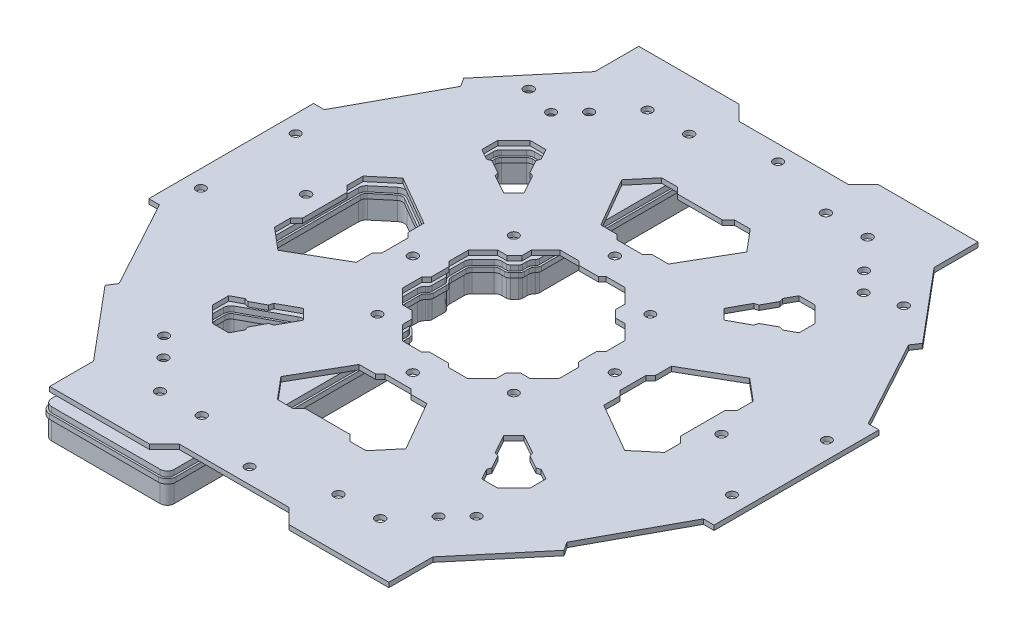
from build123d import *

# Parameters (mm, degrees)
BOSS_EXTRUDE1_DEPTH     = 1.6
CUT_EXTRUDE2_DEPTH      = 325.215508964
CUT_EXTRUDE2_DEPTH_BACK = 325.215508964
SKETCH3_R               = 1.55
SKETCH3_R_2             = 1.59
CUT_EXTRUDE3_DEPTH      = 325.215508964
CUT_EXTRUDE4_DEPTH      = 325.215508964
CUT_EXTRUDE5_DEPTH      = 325.215508964
CUT_EXTRUDE5_DEPTH_BACK = 325.215508964
SKETCH11_R              = 1.5
SKETCH11_R_2            = 1.03775
SKETCH11_R_3            = 1.25
SKETCH11_R_4            = 1.59
SKETCH11_R_5            = 3.75
SKETCH11_R_6            = 1.22275
BOSS_EXTRUDE3_DEPTH     = 1.6
FILLET1_R               = 3
CUT_EXTRUDE6_DEPTH      = 327.551906235
CUT_EXTRUDE7_DEPTH      = 327.551906235
FILLET2_R               = 2
FILLET3_R               = 2
MOVE_FACE1_BY           = 0.5
MOVE_FACE1_2_BY         = 0.5
MOVE_FACE1_3_BY         = 0.5
MOVE_FACE1_4_BY         = 0.5
MOVE_FACE1_5_BY         = 0.5
MOVE_FACE1_6_BY         = 0.5
CUT_EXTRUDE8_DEPTH      = 327.563665257
CUT_EXTRUDE8_DEPTH_BACK = 327.563665257
SKETCH16_R              = 1.25
SKETCH16_R_2            = 1.375
SKETCH15_R              = 4.385
BOSS_EXTRUDE4_DEPTH     = 10


with BuildPart() as part:
    # Sketch2 → Boss-Extrude1 (new body)
    with BuildSketch(Plane(origin=(0, 0, 0), x_dir=(1, 0, 0), z_dir=(0, 1, 0))):
        Polygon((52.096119502, -237.160208319), (52.096119502, -251.908535498), (85.721119502, -251.908535498), (90.721119502, -246.908535498), (127.471119502, -246.908535498), (132.471119502, -251.908535498), (166.096119502, -251.908535498), (166.096119502, -237.160208319), (186.224888619, -213.171675409), (184.368153405, -210.312553906), (200.496119502, -180.608535498), (204.096119502, -180.608535498), (204.096119502, -125.208535498), (200.496119502, -125.208535498), (184.368153405, -95.50451709), (186.224888619, -92.645395588), (166.096119502, -68.656862678), (166.096119502, -53.908535498), (132.471119502, -53.908535498), (127.471119502, -58.908535498), (90.721119502, -58.908535498), (85.721119502, -53.908535498), (52.096119502, -53.908535498), (52.096119502, -68.656862678), (31.967350385, -92.645395588), (33.824085599, -95.50451709), (17.696119502, -125.208535498), (14.096119502, -125.208535498), (14.096119502, -180.608535498), (17.696119502, -180.608535498), (33.824085599, -210.312553906), (31.967350385, -213.171675409), align=None)
    extrude(amount=BOSS_EXTRUDE1_DEPTH)

    # Sketch3 → Cut-Extrude2 (cut, two sides: drawn at the far end of the back side and taken through both)
    with BuildSketch(Plane(origin=(0, 0, 0), x_dir=(1, 0, 0), z_dir=(0, 1, 0)).offset(-CUT_EXTRUDE2_DEPTH_BACK)):
        with Locations((155.314639835, -81.386832051)):
            Circle(SKETCH3_R)
        with Locations((62.877599169, -81.386832051)):
            Circle(SKETCH3_R)
        with Locations((62.877599169, -224.430238946)):
            Circle(SKETCH3_R)
        with Locations((155.314639835, -224.430238946)):
            Circle(SKETCH3_R)
        with Locations((56.588874452, -87.871468679)):
            Circle(SKETCH3_R)
        with Locations((56.588874452, -217.945602318)):
            Circle(SKETCH3_R)
        with Locations((161.603364552, -87.871468679)):
            Circle(SKETCH3_R)
        with Locations((161.603364552, -217.945602318)):
            Circle(SKETCH3_R)
        with Locations((132.024071785, -175.836487781)):
            Circle(SKETCH3_R)
        with Locations((86.16816722, -175.836487781)):
            Circle(SKETCH3_R)
        with Locations((86.16816722, -129.980583216)):
            Circle(SKETCH3_R)
        with Locations((132.024071785, -129.980583216)):
            Circle(SKETCH3_R)
        with Locations((19.843114754, -136.971507714)):
            Circle(SKETCH3_R)
        with Locations((19.843114754, -168.845563283)):
            Circle(SKETCH3_R)
        with Locations((198.349124251, -136.971507714)):
            Circle(SKETCH3_R)
        with Locations((198.349124251, -168.845563283)):
            Circle(SKETCH3_R)
        with Locations((178.900678494, -152.908535498)):
            Circle(SKETCH3_R_2)
        with Locations((39.29156051, -152.908535498)):
            Circle(SKETCH3_R_2)
        with Locations((75.142742617, -152.908535498)):
            Circle(SKETCH3_R_2)
        with Locations((143.049496387, -152.908535498)):
            Circle(SKETCH3_R_2)
        with Locations((109.096119502, -118.955158614)):
            Circle(SKETCH3_R_2)
        with Locations((109.096119502, -186.861912383)):
            Circle(SKETCH3_R_2)
        with Locations((72.103705793, -71.004269418)):
            Circle(SKETCH3_R_2)
        with Locations((86.127086468, -71.004269418)):
            Circle(SKETCH3_R_2)
        with Locations((132.065152536, -71.004269418)):
            Circle(SKETCH3_R_2)
        with Locations((146.088533212, -71.004269418)):
            Circle(SKETCH3_R_2)
        with Locations((72.103705793, -234.812801579)):
            Circle(SKETCH3_R_2)
        with Locations((86.127086468, -234.812801579)):
            Circle(SKETCH3_R_2)
        with Locations((132.065152536, -234.812801579)):
            Circle(SKETCH3_R_2)
        with Locations((146.088533212, -234.812801579)):
            Circle(SKETCH3_R_2)
        with Locations((109.096119502, -64.102955151)):
            Circle(SKETCH3_R)
        with Locations((109.096119502, -241.714115846)):
            Circle(SKETCH3_R)
        with Locations((46.068110388, -84.875039907)):
            Circle(SKETCH3_R_2)
        with Locations((172.124128616, -84.875039907)):
            Circle(SKETCH3_R_2)
    extrude(amount=CUT_EXTRUDE2_DEPTH + CUT_EXTRUDE2_DEPTH_BACK, mode=Mode.SUBTRACT)

    # Sketch5 → Cut-Extrude3 (cut, through all)
    with BuildSketch(Plane(origin=(0, 0, 0), x_dir=(1, 0, 0), z_dir=(0, 1, 0))):
        Polygon((104.733231944, -113.906337065), (113.459007061, -113.906337065), (115.059007061, -112.306337065), (120.47821146, -112.306337065), (130.10321146, -95.635348043), (123.996729168, -88.357925833), (118.646729168, -88.357925833), (116.596119502, -90.408535498), (101.596119502, -90.408535498), (99.545509837, -88.357925833), (94.195509837, -88.357925833), (88.089027545, -95.635348043), (97.714027545, -112.306337065), (103.133231944, -112.306337065), align=None)
        Polygon((115.059007061, -193.510733931), (113.459007061, -191.910733931), (104.733231944, -191.910733931), (103.133231944, -193.510733931), (97.714027545, -193.510733931), (88.089027545, -210.181722954), (94.195509837, -217.459145164), (99.545509837, -217.459145164), (101.596119502, -215.408535498), (116.596119502, -215.408535498), (118.646729168, -217.459145164), (123.996729168, -217.459145164), (130.10321146, -210.181722954), (120.47821146, -193.510733931), align=None)
        Polygon((150.696119502, -158.871423057), (150.696119502, -164.290627456), (167.367108525, -173.915627456), (174.644530735, -167.809145164), (174.644530735, -162.459145164), (172.593921069, -160.408535498), (172.593921069, -145.408535498), (174.644530735, -143.357925833), (174.644530735, -138.007925833), (167.367108525, -131.901443541), (150.696119502, -141.526443541), (150.696119502, -146.94564794), (149.096119502, -148.54564794), (149.096119502, -157.271423057), align=None)
        Polygon((67.496119502, -141.526443541), (50.825130479, -131.901443541), (43.54770827, -138.007925833), (43.54770827, -143.357925833), (45.598317935, -145.408535498), (45.598317935, -160.408535498), (43.54770827, -162.459145164), (43.54770827, -167.809145164), (50.825130479, -173.915627456), (67.496119502, -164.290627456), (67.496119502, -158.871423057), (69.096119502, -157.271423057), (69.096119502, -148.54564794), (67.496119502, -146.94564794), align=None)
    extrude(amount=CUT_EXTRUDE3_DEPTH, mode=Mode.SUBTRACT)

    # Sketch9 → Cut-Extrude4 (cut, through all)
    with BuildSketch(Plane(origin=(0, 0, 0), x_dir=(1, 0, 0), z_dir=(0, 1, 0))):
        Polygon((84.346119502, -155.908535498), (84.346119502, -149.908535498), (82.766119502, -148.328535498), (82.766119502, -141.828535498), (87.666119502, -136.928535498), (90.866119502, -136.928535498), (93.366119502, -134.428535498), (93.366119502, -131.228535498), (98.166119502, -126.428535498), (104.586119502, -126.428535498), (105.886119502, -127.728535498), (112.306119502, -127.728535498), (113.606119502, -126.428535498), (120.026119502, -126.428535498), (124.826119502, -131.228535498), (124.826119502, -134.428535498), (127.326119502, -136.928535498), (130.526119502, -136.928535498), (135.426119502, -141.828535498), (135.426119502, -148.328535498), (133.846119502, -149.908535498), (133.846119502, -155.908535498), (135.426119502, -157.488535498), (135.426119502, -163.988535498), (130.526119502, -168.888535498), (127.326119502, -168.888535498), (124.826119502, -171.388535498), (124.826119502, -174.588535498), (120.026119502, -179.388535498), (113.606119502, -179.388535498), (112.306119502, -178.088535498), (105.886119502, -178.088535498), (104.586119502, -179.388535498), (98.166119502, -179.388535498), (93.366119502, -174.588535498), (93.366119502, -171.388535498), (90.866119502, -168.888535498), (87.666119502, -168.888535498), (82.766119502, -163.988535498), (82.766119502, -157.488535498), align=None)
    extrude(amount=CUT_EXTRUDE4_DEPTH, mode=Mode.SUBTRACT)

    # Sketch10 → Cut-Extrude5 (cut, two sides: drawn at the far end of the back side and taken through both)
    with BuildSketch(Plane(origin=(0, 0, 0), x_dir=(1, 0, 0), z_dir=(0, 1, 0)).offset(-CUT_EXTRUDE5_DEPTH_BACK)):
        Polygon((55.765156438, -104.981807497), (61.169391501, -99.577572434), (66.568586991, -99.594120554), (68.513414537, -103.150933011), (68.115766366, -104.508090309), (70.586272925, -109.026294774), (71.943430223, -109.423942945), (75.452480676, -115.841496206), (72.02908021, -119.264896672), (65.611526949, -115.755846219), (65.213878778, -114.398688921), (60.695674313, -111.928182362), (59.338517015, -112.325830534), (55.781704558, -110.381002987), align=None)
        Polygon((72.02908021, -186.552174325), (65.611526949, -190.061224778), (65.213878778, -191.418382076), (60.695674313, -193.888888634), (59.338517015, -193.491240463), (55.781704558, -195.436068009), (55.765156438, -200.8352635), (61.169391501, -206.239498563), (66.568586991, -206.222950443), (68.513414537, -202.666137986), (68.115766366, -201.308980688), (70.586272925, -196.790776223), (71.943430223, -196.393128052), (75.452480676, -189.975574791), align=None)
        Polygon((162.427082567, -200.8352635), (157.022847504, -206.239498563), (151.623652013, -206.222950443), (149.678824467, -202.666137986), (150.076472638, -201.308980688), (147.60596608, -196.790776223), (146.248808781, -196.393128052), (142.739758329, -189.975574791), (146.163158795, -186.552174325), (152.580712056, -190.061224778), (152.978360227, -191.418382076), (157.496564692, -193.888888634), (158.85372199, -193.491240463), (162.410534446, -195.436068009), align=None)
        Polygon((146.163158795, -119.264896672), (152.580712056, -115.755846219), (152.978360227, -114.398688921), (157.496564692, -111.928182362), (158.85372199, -112.325830534), (162.410534446, -110.381002987), (162.427082567, -104.981807497), (157.022847504, -99.577572434), (151.623652013, -99.594120554), (149.678824467, -103.150933011), (150.076472638, -104.508090309), (147.60596608, -109.026294774), (146.248808781, -109.423942945), (142.739758329, -115.841496206), align=None)
    extrude(amount=CUT_EXTRUDE5_DEPTH + CUT_EXTRUDE5_DEPTH_BACK, mode=Mode.SUBTRACT)


with BuildPart() as body_2:
    # Sketch11 → Boss-Extrude3 (new body)
    with BuildSketch(Plane(origin=(0, 0, 0), x_dir=(1, 0, 0), z_dir=(0, 1, 0))):
        Polygon((94.596119502, -175.818535498), (93.366119502, -174.588535498), (93.366119502, -171.388535498), (90.866119502, -168.888535498), (87.666119502, -168.888535498), (82.766119502, -163.988535498), (82.766119502, -157.488535498), (84.346119502, -155.908535498), (84.346119502, -149.908535498), (82.766119502, -148.328535498), (82.766119502, -141.828535498), (87.666119502, -136.928535498), (90.866119502, -136.928535498), (93.366119502, -134.428535498), (93.366119502, -131.228535498), (94.596119502, -129.998535498), (94.596119502, -53.908535498), (52.096119502, -53.908535498), (52.096119502, -68.656862678), (31.967350385, -92.645395588), (33.824085599, -95.50451709), (24.096119502, -113.421201828), (24.096119502, -192.395869169), (33.824085599, -210.312553906), (32.152138529, -213.391897343), (52.096119502, -237.160208319), (52.096119502, -254.908535498), (94.596119502, -254.908535498), align=None)
        with BuildLine():
            ThreePointArc((36.045744784, -192.908535498), (37.395744784, -191.558535498), (38.745744784, -192.908535498))
            ThreePointArc((38.745744784, -192.908535498), (37.395744784, -194.258535498), (36.045744784, -192.908535498))
        make_face(mode=Mode.SUBTRACT)
        with Locations((41.901157442, -175.408535498)):
            Circle(SKETCH11_R, mode=Mode.SUBTRACT)
        with Locations((72.103705793, -234.812801579)):
            Circle(SKETCH11_R_2, mode=Mode.SUBTRACT)
        with BuildLine():
            ThreePointArc((53.896870849, -220.556275909), (53.978200861, -215.253598715), (59.280878055, -215.334928726))
            Line((59.280878055, -215.334928726), (65.569602772, -221.819565354))
            ThreePointArc((65.569602772, -221.819565354), (65.488272761, -227.122242548), (60.185595566, -227.040912537))
            Line((60.185595566, -227.040912537), (53.896870849, -220.556275909))
        make_face(mode=Mode.SUBTRACT)
        with BuildLine():
            ThreePointArc((85.045744784, -250.908535498), (86.395744784, -249.558535498), (87.745744784, -250.908535498))
            ThreePointArc((87.745744784, -250.908535498), (86.395744784, -252.258535498), (85.045744784, -250.908535498))
        make_face(mode=Mode.SUBTRACT)
        with Locations((86.103705793, -234.812801579)):
            Circle(SKETCH11_R_2, mode=Mode.SUBTRACT)
        with Locations((92.206195383, -220.408566663)):
            Circle(SKETCH11_R_3, mode=Mode.SUBTRACT)
        with Locations((92.206195383, -210.408535498)):
            Circle(SKETCH11_R_3, mode=Mode.SUBTRACT)
        Polygon((55.765156438, -200.8352635), (55.781704558, -195.436068009), (59.338517015, -193.491240463), (60.695674313, -193.888888634), (65.213878778, -191.418382076), (65.611526949, -190.061224778), (72.02908021, -186.552174325), (75.452480676, -189.975574791), (71.943430223, -196.393128052), (70.586272925, -196.790776223), (68.115766366, -201.308980688), (68.513414537, -202.666137986), (66.568586991, -206.222950443), (61.169391501, -206.239498563), align=None, mode=Mode.SUBTRACT)
        with BuildLine():
            ThreePointArc((85.045744784, -192.908535498), (86.395744784, -191.558535498), (87.745744784, -192.908535498))
            ThreePointArc((87.745744784, -192.908535498), (86.395744784, -194.258535498), (85.045744784, -192.908535498))
        make_face(mode=Mode.SUBTRACT)
        with Locations((86.901157442, -175.408535498)):
            Circle(SKETCH11_R, mode=Mode.SUBTRACT)
        with Locations((39.29156051, -152.908535498)):
            Circle(SKETCH11_R_4, mode=Mode.SUBTRACT)
        with Locations((41.901157442, -130.408535498)):
            Circle(SKETCH11_R, mode=Mode.SUBTRACT)
        Polygon((50.825130479, -173.915627456), (43.54770827, -167.809145164), (43.54770827, -162.459145164), (45.598317935, -160.408535498), (45.598317935, -145.408535498), (43.54770827, -143.357925833), (43.54770827, -138.007925833), (50.825130479, -131.901443541), (67.496119502, -141.526443541), (67.496119502, -146.94564794), (69.096119502, -148.54564794), (69.096119502, -157.271423057), (67.496119502, -158.871423057), (67.496119502, -164.290627456), align=None, mode=Mode.SUBTRACT)
        with Locations((46.068110388, -84.875039907)):
            Circle(SKETCH11_R_5, mode=Mode.SUBTRACT)
        with Locations((75.142742617, -152.908535498)):
            Circle(SKETCH11_R_4, mode=Mode.SUBTRACT)
        Polygon((65.611526949, -115.755846219), (65.213878778, -114.398688921), (60.695674313, -111.928182362), (59.338517015, -112.325830534), (55.781704558, -110.381002987), (55.765156438, -104.981807497), (61.169391501, -99.577572434), (66.568586991, -99.594120554), (68.513414537, -103.150933011), (68.115766366, -104.508090309), (70.586272925, -109.026294774), (71.943430223, -109.423942945), (75.452480676, -115.841496206), (72.02908021, -119.264896672), align=None, mode=Mode.SUBTRACT)
        with Locations((86.901157442, -130.408535498)):
            Circle(SKETCH11_R, mode=Mode.SUBTRACT)
        with BuildLine():
            ThreePointArc((59.280878055, -90.482142271), (53.978200861, -90.563472282), (53.896870849, -85.260795088))
            Line((53.896870849, -85.260795088), (60.185595566, -78.77615846))
            ThreePointArc((60.185595566, -78.77615846), (65.488272761, -78.694828448), (65.569602772, -83.997505643))
            Line((65.569602772, -83.997505643), (59.280878055, -90.482142271))
        make_face(mode=Mode.SUBTRACT)
        with Locations((72.103705793, -71.004269418)):
            Circle(SKETCH11_R_2, mode=Mode.SUBTRACT)
        with Locations((92.206195383, -95.408504334)):
            Circle(SKETCH11_R_3, mode=Mode.SUBTRACT)
        with Locations((92.206195383, -85.408504334)):
            Circle(SKETCH11_R_3, mode=Mode.SUBTRACT)
        with Locations((86.103705793, -71.004269418)):
            Circle(SKETCH11_R_6, mode=Mode.SUBTRACT)
    extrude(amount=-BOSS_EXTRUDE3_DEPTH)

    # Fillet1
    fillet1_edges = [body_2.edges().sort_by_distance(p)[0] for p in [
        (24.096119502, -0.8, 113.421201828),
        (24.096119502, -0.8, 192.395869169),
        (94.596119502, -0.8, 53.908535498),
        (52.096119502, -0.8, 53.908535498),
        (52.096119502, -0.8, 254.908535498),
        (94.596119502, -0.8, 254.908535498),
    ]]
    fillet(fillet1_edges, radius=FILLET1_R)

    # Sketch12 → Cut-Extrude6 (cut, through all)
    with BuildSketch(Plane(origin=(0, 0, 0), x_dir=(1, 0, 0), z_dir=(0, 1, 0))):
        Polygon((85.721119502, -53.908535498), (89.721119502, -57.908535498), (94.596119502, -57.908535498), (94.596119502, -53.908535498), align=None)
    extrude(amount=-CUT_EXTRUDE6_DEPTH, mode=Mode.SUBTRACT)

    # Sketch14 → Cut-Extrude7 (cut, through all)
    with BuildSketch(Plane(origin=(0, 0, 0), x_dir=(1, 0, 0), z_dir=(0, 1, 0))):
        Polygon((43.54770827, -143.357925833), (43.54770827, -162.459145164), (45.598317935, -160.408535498), (45.598317935, -145.408535498), align=None)
        Polygon((67.496119502, -158.871423057), (67.496119502, -164.290627456), (69.096119502, -163.366867025), (69.096119502, -157.271423057), align=None)
        Polygon((69.096119502, -142.450203972), (67.496119502, -141.526443541), (67.496119502, -146.94564794), (69.096119502, -148.54564794), align=None)
        Polygon((70.586272925, -109.026294774), (71.943430223, -109.423942945), (68.513414537, -103.150933011), (68.115766366, -104.508090309), align=None)
        Polygon((59.338517015, -112.325830534), (65.611526949, -115.755846219), (65.213878778, -114.398688921), (60.695674313, -111.928182362), align=None)
        Polygon((68.115766366, -201.308980688), (68.513414537, -202.666137986), (71.943430223, -196.393128052), (70.586272925, -196.790776223), align=None)
        Polygon((65.213878778, -191.418382076), (65.611526949, -190.061224778), (59.338517015, -193.491240463), (60.695674313, -193.888888634), align=None)
    extrude(amount=-CUT_EXTRUDE7_DEPTH, mode=Mode.SUBTRACT)

    # Fillet2
    fillet2_edges = [body_2.edges().sort_by_distance(p)[0] for p in [
        (61.169391501, -0.8, 206.239498563),
        (55.765156438, -0.8, 200.8352635),
        (55.781704558, -0.8, 195.436068009),
        (72.02908021, -0.8, 186.552174325),
        (75.452480676, -0.8, 189.975574791),
        (66.568586991, -0.8, 206.222950443),
        (50.825130479, -0.8, 173.915627456),
        (43.54770827, -0.8, 167.809145164),
        (43.54770827, -0.8, 138.007925833),
        (50.825130479, -0.8, 131.901443541),
        (55.781704558, -0.8, 110.381002987),
        (55.765156438, -0.8, 104.981807497),
        (61.169391501, -0.8, 99.577572434),
        (66.568586991, -0.8, 99.594120554),
        (75.452480676, -0.8, 115.841496206),
        (72.02908021, -0.8, 119.264896672),
        (69.096119502, -0.8, 142.450203972),
        (69.096119502, -0.8, 163.366867025),
    ]]
    fillet(fillet2_edges, radius=FILLET2_R)

    # Fillet3
    fillet3_edges = [body_2.edges().sort_by_distance(p)[0] for p in [
        (85.721119502, -0.8, 53.908535498),
        (52.096119502, -0.8, 68.656862678),
        (31.967350385, -0.8, 92.645395588),
        (33.824085599, -0.8, 95.50451709),
        (33.824085599, -0.8, 210.312553906),
        (32.152138529, -0.8, 213.391897343),
        (52.096119502, -0.8, 237.160208319),
        (93.366119502, -0.8, 174.588535498),
        (93.366119502, -0.8, 171.388535498),
        (90.866119502, -0.8, 168.888535498),
        (87.666119502, -0.8, 168.888535498),
        (82.766119502, -0.8, 163.988535498),
        (82.766119502, -0.8, 157.488535498),
        (84.346119502, -0.8, 155.908535498),
        (84.346119502, -0.8, 149.908535498),
        (82.766119502, -0.8, 148.328535498),
        (82.766119502, -0.8, 141.828535498),
        (87.666119502, -0.8, 136.928535498),
        (90.866119502, -0.8, 136.928535498),
        (93.366119502, -0.8, 134.428535498),
        (93.366119502, -0.8, 131.228535498),
        (94.596119502, -0.8, 129.998535498),
        (94.596119502, -0.8, 57.908535498),
        (89.721119502, -0.8, 57.908535498),
        (94.596119502, -0.8, 175.818535498),
    ]]
    fillet(fillet3_edges, radius=FILLET3_R)

    # Move Face1: a curved face moved outward by 0.5
    add(Solid.thicken(body_2.faces().sort_by_distance((85.401157442, -0.8, 175.408535498))[0], MOVE_FACE1_BY))

    # Move Face1 2: a curved face moved outward by 0.5
    add(Solid.thicken(body_2.faces().sort_by_distance((40.401157442, -0.8, 175.408535498))[0], MOVE_FACE1_2_BY))

    # Move Face1 3: a curved face moved outward by 0.5
    add(Solid.thicken(body_2.faces().sort_by_distance((85.401157442, -0.8, 130.408535498))[0], MOVE_FACE1_3_BY))

    # Move Face1 4: a curved face moved outward by 0.5
    add(Solid.thicken(body_2.faces().sort_by_distance((73.552742617, -0.8, 152.908535498))[0], MOVE_FACE1_4_BY))

    # Move Face1 5: a curved face moved outward by 0.5
    add(Solid.thicken(body_2.faces().sort_by_distance((40.401157442, -0.8, 130.408535498))[0], MOVE_FACE1_5_BY))

    # Move Face1 6: a curved face moved outward by 0.5
    add(Solid.thicken(body_2.faces().sort_by_distance((37.70156051, -0.8, 152.908535498))[0], MOVE_FACE1_6_BY))

    # Sketch16 → Cut-Extrude8 (cut, two sides: drawn at the far end of the back side and taken through both)
    with BuildSketch(Plane.XZ.offset(1.6).offset(-CUT_EXTRUDE8_DEPTH_BACK)):
        with Locations((86.103705793, 71.004269418)):
            Circle(SKETCH16_R)
        with Locations((72.103705793, 71.004269418)):
            Circle(SKETCH16_R)
        with Locations((92.206195383, 85.408504334)):
            Circle(SKETCH16_R)
        with Locations((92.206195383, 95.408504334)):
            Circle(SKETCH16_R)
        with Locations((41.901157442, 130.408535498)):
            Circle(SKETCH16_R_2)
        with Locations((86.901157442, 130.408535498)):
            Circle(SKETCH16_R_2)
        with Locations((75.142742617, 152.908535498)):
            Circle(SKETCH16_R)
        with Locations((39.29156051, 152.908535498)):
            Circle(SKETCH16_R)
        with Locations((41.901157442, 175.408535498)):
            Circle(SKETCH16_R_2)
        with Locations((86.901157442, 175.408535498)):
            Circle(SKETCH16_R_2)
        with Locations((86.395744784, 192.908535498)):
            Circle(SKETCH16_R_2)
        with Locations((92.206195383, 210.408535498)):
            Circle(SKETCH16_R)
        with Locations((92.206195383, 220.408566663)):
            Circle(SKETCH16_R)
        with Locations((37.395744784, 192.908535498)):
            Circle(SKETCH16_R_2)
        with Locations((72.103705793, 234.812801579)):
            Circle(SKETCH16_R)
        with Locations((86.103705793, 234.812801579)):
            Circle(SKETCH16_R)
        with Locations((86.395744784, 250.908535498)):
            Circle(SKETCH16_R_2)
    extrude(amount=CUT_EXTRUDE8_DEPTH + CUT_EXTRUDE8_DEPTH_BACK, mode=Mode.SUBTRACT)


with BuildPart() as body_3:
    # Sketch15 → Boss-Extrude4 (new body)
    with BuildSketch(Plane.XZ.offset(1.6)):
        with BuildLine():
            Line((55.096119502, 54.548535498), (84.892692378, 54.548535498))
            ThreePointArc((84.892692378, 54.548535498), (85.413141846, 54.652059334), (85.8543576, 54.946870276))
            Line((85.8543576, 54.946870276), (88.682784725, 57.775297401))
            ThreePointArc((88.682784725, 57.775297401), (89.539262366, 58.347577464), (90.549546627, 58.548535498))
            Line((90.549546627, 58.548535498), (92.596119502, 58.548535498))
            ThreePointArc((92.596119502, 58.548535498), (93.557784725, 58.946870276), (93.956119502, 59.908535498))
            Line((93.956119502, 59.908535498), (93.956119502, 129.170108374))
            ThreePointArc((93.956119502, 129.170108374), (93.852595666, 129.690557842), (93.557784725, 130.131773596))
            Line((93.557784725, 130.131773596), (93.4993576, 130.190200721))
            ThreePointArc((93.4993576, 130.190200721), (92.927077536, 131.046678362), (92.726119502, 132.056962623))
            Line((92.726119502, 132.056962623), (92.726119502, 133.600108374))
            ThreePointArc((92.726119502, 133.600108374), (92.622595666, 134.120557842), (92.327784725, 134.561773596))
            Line((92.327784725, 134.561773596), (90.9993576, 135.890200721))
            ThreePointArc((90.9993576, 135.890200721), (90.558141846, 136.185011663), (90.037692378, 136.288535498))
            Line((90.037692378, 136.288535498), (88.494546627, 136.288535498))
            ThreePointArc((88.494546627, 136.288535498), (87.484262366, 136.489493533), (86.627784725, 137.061773596))
            Line((86.627784725, 137.061773596), (82.8993576, 140.790200721))
            ThreePointArc((82.8993576, 140.790200721), (82.327077536, 141.646678362), (82.126119502, 142.656962623))
            Line((82.126119502, 142.656962623), (82.126119502, 147.500108374))
            ThreePointArc((82.126119502, 147.500108374), (82.327077536, 148.510392635), (82.8993576, 149.366870276))
            Line((82.8993576, 149.366870276), (83.307784725, 149.775297401))
            ThreePointArc((83.307784725, 149.775297401), (83.602595666, 150.216513155), (83.706119502, 150.736962623))
            Line((83.706119502, 150.736962623), (83.706119502, 155.080108374))
            ThreePointArc((83.706119502, 155.080108374), (83.602595666, 155.600557842), (83.307784725, 156.041773596))
            Line((83.307784725, 156.041773596), (82.8993576, 156.450200721))
            ThreePointArc((82.8993576, 156.450200721), (82.327077536, 157.306678362), (82.126119502, 158.316962623))
            Line((82.126119502, 158.316962623), (82.126119502, 163.160108374))
            ThreePointArc((82.126119502, 163.160108374), (82.327077536, 164.170392635), (82.8993576, 165.026870276))
            Line((82.8993576, 165.026870276), (86.627784725, 168.755297401))
            ThreePointArc((86.627784725, 168.755297401), (87.484262366, 169.327577464), (88.494546627, 169.528535498))
            Line((88.494546627, 169.528535498), (90.037692378, 169.528535498))
            ThreePointArc((90.037692378, 169.528535498), (90.558141846, 169.632059334), (90.9993576, 169.926870276))
            Line((90.9993576, 169.926870276), (92.327784725, 171.255297401))
            ThreePointArc((92.327784725, 171.255297401), (92.622595666, 171.696513155), (92.726119502, 172.216962623))
            Line((92.726119502, 172.216962623), (92.726119502, 173.760108374))
            ThreePointArc((92.726119502, 173.760108374), (92.927077536, 174.770392635), (93.4993576, 175.626870276))
            Line((93.4993576, 175.626870276), (93.557784725, 175.685297401))
            ThreePointArc((93.557784725, 175.685297401), (93.852595666, 176.126513155), (93.956119502, 176.646962623))
            Line((93.956119502, 176.646962623), (93.956119502, 251.908535498))
            ThreePointArc((93.956119502, 251.908535498), (93.264891506, 253.577307502), (91.596119502, 254.268535498))
            Line((91.596119502, 254.268535498), (55.096119502, 254.268535498))
            ThreePointArc((55.096119502, 254.268535498), (53.427347499, 253.577307502), (52.736119502, 251.908535498))
            Line((52.736119502, 251.908535498), (52.736119502, 237.888148787))
            ThreePointArc((52.736119502, 237.888148787), (52.576908021, 236.985215609), (52.118476832, 236.191189498))
            Line((52.118476832, 236.191189498), (33.517723983, 214.023675465))
            ThreePointArc((33.517723983, 214.023675465), (33.206387241, 213.28574008), (33.364353153, 212.500548402))
            Line((33.364353153, 212.500548402), (33.868376414, 211.572253033))
            ThreePointArc((33.868376414, 211.572253033), (34.188299237, 210.312553906), (33.868376414, 209.052854779))
            Line((33.868376414, 209.052854779), (25.022111116, 192.760060904))
            ThreePointArc((25.022111116, 192.760060904), (24.808734555, 192.214888001), (24.736119502, 191.63396623))
            Line((24.736119502, 191.63396623), (24.736119502, 114.183104767))
            ThreePointArc((24.736119502, 114.183104767), (24.808734555, 113.602182996), (25.022111116, 113.057010093))
            Line((25.022111116, 113.057010093), (33.818769289, 96.855581176))
            ThreePointArc((33.818769289, 96.855581176), (34.136656767, 95.492236136), (33.712782411, 94.158034997))
            Line((33.712782411, 94.158034997), (33.31012292, 93.537993755))
            ThreePointArc((33.31012292, 93.537993755), (33.093251567, 92.714258654), (33.40889445, 91.923093519))
            Line((33.40889445, 91.923093519), (52.118476832, 69.625881499))
            ThreePointArc((52.118476832, 69.625881499), (52.576908021, 68.831855388), (52.736119502, 67.92892221))
            Line((52.736119502, 67.92892221), (52.736119502, 56.908535498))
            ThreePointArc((52.736119502, 56.908535498), (53.427347499, 55.239763495), (55.096119502, 54.548535498))
        make_face()
        with Locations((46.068110388, 84.875039907)):
            Circle(SKETCH15_R, mode=Mode.SUBTRACT)
        with BuildLine():
            Line((59.736723999, 214.892854664), (66.025448716, 221.377491292))
            ThreePointArc((66.025448716, 221.377491292), (65.930346822, 227.578088492), (59.729749623, 227.482986599))
            Line((59.729749623, 227.482986599), (53.441024906, 220.998349971))
            ThreePointArc((53.441024906, 220.998349971), (53.536126799, 214.797752771), (59.736723999, 214.892854664))
        make_face(mode=Mode.SUBTRACT)
        with BuildLine():
            Line((60.132051585, 206.100184259), (55.904470742, 201.872603416))
            ThreePointArc((55.904470742, 201.872603416), (55.331732116, 201.014016062), (55.132709486, 200.001301012))
            Line((55.132709486, 200.001301012), (55.143085623, 196.615853568))
            ThreePointArc((55.143085623, 196.615853568), (55.51361064, 195.276549144), (56.513919972, 194.311973398))
            Line((56.513919972, 194.311973398), (70.4100162, 186.713734509))
            ThreePointArc((70.4100162, 186.713734509), (72.048417734, 186.417403299), (73.537395843, 187.162464346))
            Line((73.537395843, 187.162464346), (74.842190655, 188.467259157))
            ThreePointArc((74.842190655, 188.467259157), (75.587251701, 189.956237266), (75.290920492, 191.5946388))
            Line((75.290920492, 191.5946388), (67.692681603, 205.490735028))
            ThreePointArc((67.692681603, 205.490735028), (66.728105857, 206.49104436), (65.388801432, 206.861569377))
            Line((65.388801432, 206.861569377), (62.003353988, 206.871945514))
            ThreePointArc((62.003353988, 206.871945514), (60.990638939, 206.672922884), (60.132051585, 206.100184259))
        make_face(mode=Mode.SUBTRACT)
        with BuildLine():
            Line((69.731119502, 143.60490451), (69.731119502, 162.212166487))
            ThreePointArc((69.731119502, 162.212166487), (69.378096441, 163.529666487), (68.413619502, 164.494143426))
            Line((68.413619502, 164.494143426), (52.355425511, 173.765346049))
            ThreePointArc((52.355425511, 173.765346049), (50.808270129, 174.10834214), (49.34418016, 173.501896218))
            Line((49.34418016, 173.501896218), (43.853962918, 168.895056955))
            ThreePointArc((43.853962918, 168.895056955), (43.159587251, 167.990128967), (42.91270827, 166.876529848))
            Line((42.91270827, 166.876529848), (42.91270827, 138.940541149))
            ThreePointArc((42.91270827, 138.940541149), (43.159587251, 137.82694203), (43.853962918, 136.922014042))
            Line((43.853962918, 136.922014042), (49.34418016, 132.315174779))
            ThreePointArc((49.34418016, 132.315174779), (50.808270129, 131.708728857), (52.355425511, 132.051724948))
            Line((52.355425511, 132.051724948), (68.413619502, 141.322927571))
            ThreePointArc((68.413619502, 141.322927571), (69.378096441, 142.28740451), (69.731119502, 143.60490451))
        make_face(mode=Mode.SUBTRACT)
        with BuildLine():
            Line((53.441024906, 84.818721026), (59.729749623, 78.334084398))
            ThreePointArc((59.729749623, 78.334084398), (65.930346822, 78.238982505), (66.025448716, 84.439579704))
            Line((66.025448716, 84.439579704), (59.736723999, 90.924216332))
            ThreePointArc((59.736723999, 90.924216332), (53.536126799, 91.019318226), (53.441024906, 84.818721026))
        make_face(mode=Mode.SUBTRACT)
        with BuildLine():
            Line((55.143085623, 109.201217428), (55.132709486, 105.815769984))
            ThreePointArc((55.132709486, 105.815769984), (55.331732116, 104.803054935), (55.904470742, 103.944467581))
            Line((55.904470742, 103.944467581), (60.132051585, 99.716886738))
            ThreePointArc((60.132051585, 99.716886738), (60.990638939, 99.144148113), (62.003353988, 98.945125483))
            Line((62.003353988, 98.945125483), (65.388801432, 98.955501619))
            ThreePointArc((65.388801432, 98.955501619), (66.728105857, 99.326026637), (67.692681603, 100.326335969))
            Line((67.692681603, 100.326335969), (75.290920492, 114.222432196))
            ThreePointArc((75.290920492, 114.222432196), (75.587251701, 115.860833731), (74.842190655, 117.34981184))
            Line((74.842190655, 117.34981184), (73.537395843, 118.654606651))
            ThreePointArc((73.537395843, 118.654606651), (72.048417734, 119.399667698), (70.4100162, 119.103336488))
            Line((70.4100162, 119.103336488), (56.513919972, 111.505097599))
            ThreePointArc((56.513919972, 111.505097599), (55.51361064, 110.540521853), (55.143085623, 109.201217428))
        make_face(mode=Mode.SUBTRACT)
    extrude(amount=BOSS_EXTRUDE4_DEPTH)


with BuildPart() as body_2_1:
    # Body-Move/Copy1: moved
    add(body_2.part.moved(Location((0, -3.4, 0))))


solid = Compound([part.part, body_3.part, body_2_1.part])
